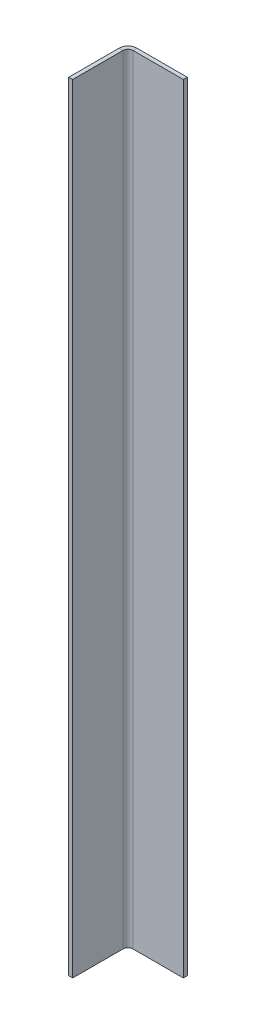
from build123d import *

# Parameters (mm, degrees)
SKETCH1_W                    = 30
SKETCH1_H                    = 394
BASE_FLANGE1_DEPTH           = 2
EDGE_FLANGE1_STRIP_W         = 13
EDGE_FLANGE1_STRIP_H         = 2
EDGE_FLANGE1_STRIP_CUT_DEPTH = 394
EDGE_FLANGE1_DEPTH           = 394


# Sheet-metal steps are written as plain solids
with BuildPart() as part:
    # Sketch1 → Base-Flange1 (new body)
    with BuildSketch(Plane(origin=(0, 0, 0), x_dir=(0, 0, -1), z_dir=(1, 0, 0))):
        Rectangle(SKETCH1_W, SKETCH1_H)
    extrude(amount=-BASE_FLANGE1_DEPTH)

    # Edge-Flange1 strip (across the edge) → Edge-Flange1 strip cut (cut)
    with BuildSketch(Plane(origin=(0, -197, -15), x_dir=(0, 0, 1), z_dir=(0, 1, 0))):
        with Locations((-2, -1)):
            Rectangle(EDGE_FLANGE1_STRIP_W, EDGE_FLANGE1_STRIP_H)
    extrude(amount=EDGE_FLANGE1_STRIP_CUT_DEPTH, mode=Mode.SUBTRACT)

    # Edge-Flange1 section (across the edge) → Edge-Flange1 (add)
    with BuildSketch(Plane(origin=(0, -197, -15), x_dir=(0, 0, 1), z_dir=(0, 1, 0))):
        with BuildLine():
            Line((0, 2.5), (0, 28))
            Line((0, 28), (2, 28))
            Line((2, 28), (2, 2.5))
            ThreePointArc((2, 2.5), (2.732233047, 0.732233047), (4.5, 0))
            Line((4.5, 0), (4.5, -2))
            ThreePointArc((4.5, -2), (1.318019485, -0.681980515), (0, 2.5))
        make_face()
    extrude(amount=EDGE_FLANGE1_DEPTH)


solid = part.part
